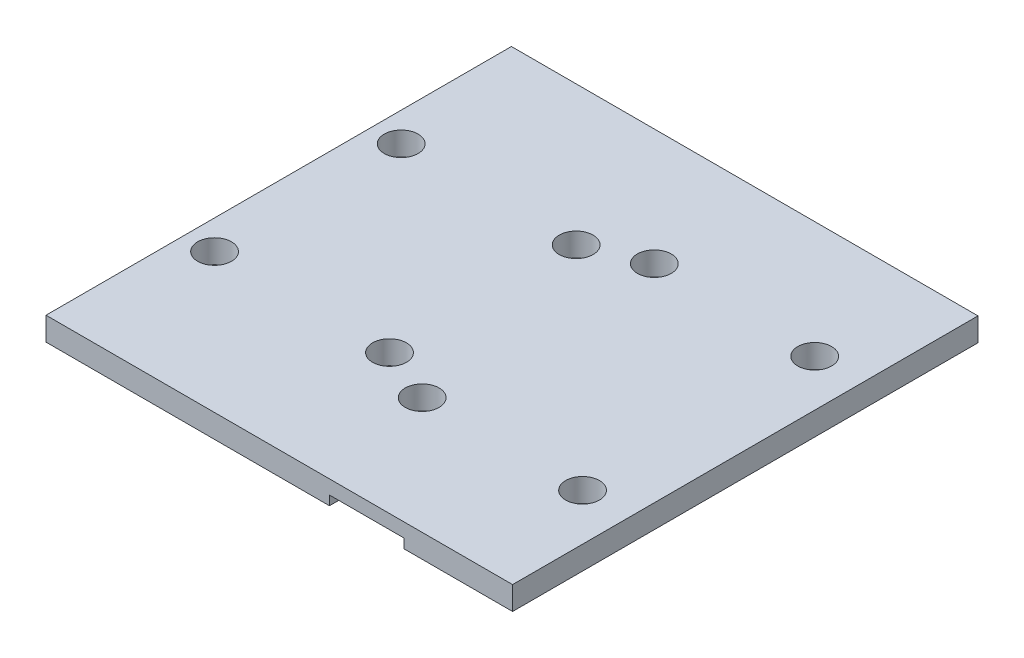
from build123d import *

# Parameters (mm, degrees)
SKETCH_1_W          = 40
SKETCH_1_H          = 39.9
EXTRUDE_1_DEPTH     = 2
SKETCH_2_R          = 1.45
CUT_EXTRUDE_1_DEPTH = 2
CUT_EXTRUDE_3_REACH = 58.533
SKETCH_5_R          = 1.45
SKETCH_7_W          = 6.4
SKETCH_7_H          = 39.9
CUT_EXTRUDE_5_DEPTH = 0.8


with BuildPart() as part:
    # 草图1 → 凸台-拉伸1 (new body)
    with BuildSketch(Plane(origin=(0, 0, 0), x_dir=(1, 0, 0), z_dir=(0, 1, 0))):
        with Locations((20, 19.95)):
            Rectangle(SKETCH_1_W, SKETCH_1_H)
    extrude(amount=EXTRUDE_1_DEPTH)

    # 草图2 → 切除-拉伸1 (cut)
    with BuildSketch(Plane(origin=(0, 2, 0), x_dir=(1, 0, 0), z_dir=(0, 1, 0))):
        with Locations((2.5, 11.95)):
            Circle(SKETCH_2_R)
        with Locations((17.5, 11.95)):
            Circle(SKETCH_2_R)
        with Locations((17.5, 27.95)):
            Circle(SKETCH_2_R)
        with Locations((2.5, 27.95)):
            Circle(SKETCH_2_R)
    extrude(amount=-CUT_EXTRUDE_1_DEPTH, mode=Mode.SUBTRACT)

    # 草图5 → 切除-拉伸3 (cut, up to next)
    with BuildSketch(Plane.XZ, mode=Mode.PRIVATE) as cut_extrude_3_sk1:
        with Locations((22.25, -10)):
            Circle(SKETCH_5_R)
    cut_extrude_3_tool1 = extrude(cut_extrude_3_sk1.sketch, amount=-CUT_EXTRUDE_3_REACH, mode=Mode.PRIVATE) & part.part
    # 草图5 → 切除-拉伸3 (cut, up to next)
    with BuildSketch(Plane.XZ, mode=Mode.PRIVATE) as cut_extrude_3_sk2:
        with Locations((36, -10)):
            Circle(SKETCH_5_R)
    cut_extrude_3_tool2 = extrude(cut_extrude_3_sk2.sketch, amount=-CUT_EXTRUDE_3_REACH, mode=Mode.PRIVATE) & part.part
    # 草图5 → 切除-拉伸3 (cut, up to next)
    with BuildSketch(Plane.XZ, mode=Mode.PRIVATE) as cut_extrude_3_sk3:
        with Locations((36, -29.9)):
            Circle(SKETCH_5_R)
    cut_extrude_3_tool3 = extrude(cut_extrude_3_sk3.sketch, amount=-CUT_EXTRUDE_3_REACH, mode=Mode.PRIVATE) & part.part
    # 草图5 → 切除-拉伸3 (cut, up to next)
    with BuildSketch(Plane.XZ, mode=Mode.PRIVATE) as cut_extrude_3_sk4:
        with Locations((22.25, -29.9)):
            Circle(SKETCH_5_R)
    cut_extrude_3_tool4 = extrude(cut_extrude_3_sk4.sketch, amount=-CUT_EXTRUDE_3_REACH, mode=Mode.PRIVATE) & part.part
    add(cut_extrude_3_tool1.solids().sort_by_distance((22.25, 0, -10))[0], mode=Mode.SUBTRACT)
    add(cut_extrude_3_tool2.solids().sort_by_distance((36, 0, -10))[0], mode=Mode.SUBTRACT)
    add(cut_extrude_3_tool3.solids().sort_by_distance((36, 0, -29.9))[0], mode=Mode.SUBTRACT)
    add(cut_extrude_3_tool4.solids().sort_by_distance((22.25, 0, -29.9))[0], mode=Mode.SUBTRACT)

    # 草图7 → 切除-拉伸5 (cut)
    with BuildSketch(Plane.XZ):
        with Locations((27.5, -19.95)):
            Rectangle(SKETCH_7_W, SKETCH_7_H)
    extrude(amount=-CUT_EXTRUDE_5_DEPTH, mode=Mode.SUBTRACT)


solid = part.part
